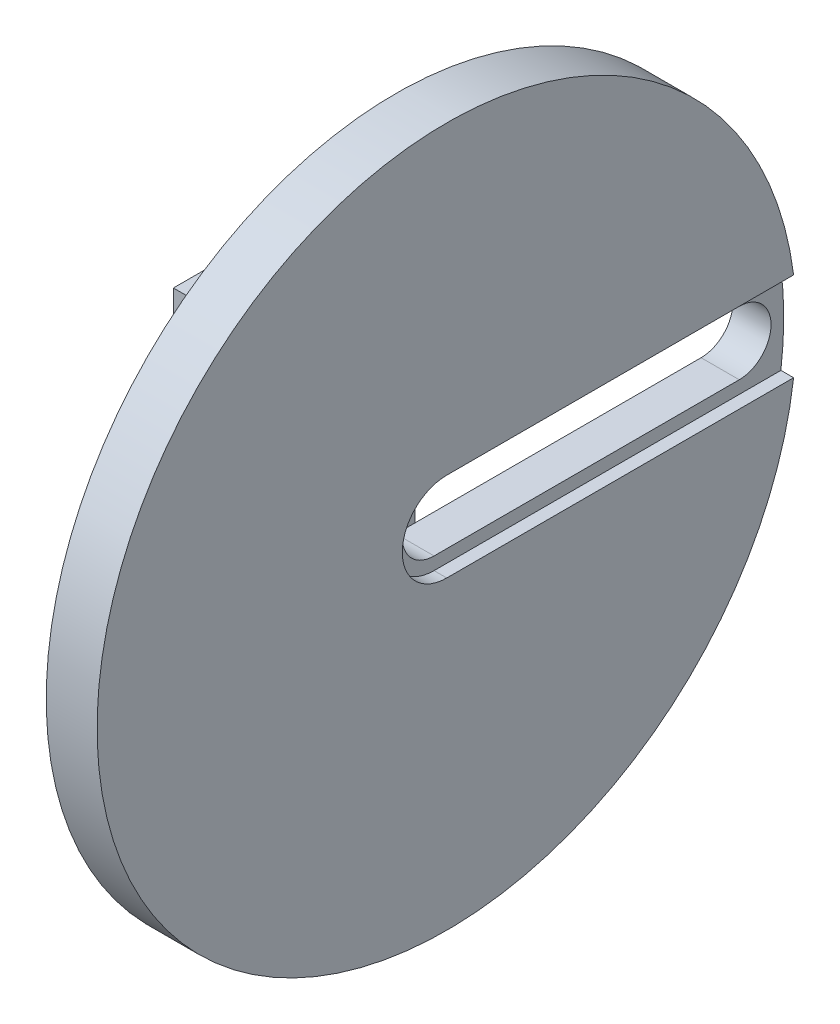
from build123d import *

# Parameters (mm, degrees)
SKETCH_1_R          = 7.5
EXTRUDE_1_DEPTH     = 10
SKETCH_5_W          = 30
SKETCH_5_H          = 52
EXTRUDE_2_DEPTH     = 8
SKETCH_6_W          = 30
SKETCH_6_H          = 8
EXTRUDE_3_DEPTH     = 12
SKETCH_7_R          = 55
EXTRUDE_4_DEPTH     = 8
CUT_EXTRUDE_4_REACH = 88.568
CUT_EXTRUDE_START   = -2
CUT_EXTRUDE_6_DEPTH = 2
CUT_EXTRUDE_7_REACH = 88.568
SKETCH_12_R         = 9


with BuildPart() as part:
    # 草图1 → 凸台-拉伸1 (new body)
    with BuildSketch(Plane(origin=(0, 0, 0), x_dir=(0, 0, -1), z_dir=(1, 0, 0))):
        Circle(SKETCH_1_R)
    extrude(amount=EXTRUDE_1_DEPTH)

    # 草图5 → 凸台-拉伸2 (add)
    with BuildSketch(Plane(origin=(10, 0, 0), x_dir=(0, 0, -1), z_dir=(1, 0, 0))):
        Rectangle(SKETCH_5_W, SKETCH_5_H)
    extrude(amount=EXTRUDE_2_DEPTH)

    # 草图6 → 凸台-拉伸3 (add)
    with BuildSketch(Plane(origin=(18, 0, 0), x_dir=(0, 0, -1), z_dir=(1, 0, 0))):
        with Locations((0, 22)):
            Rectangle(SKETCH_6_W, SKETCH_6_H)
        with Locations((0, -22)):
            Rectangle(SKETCH_6_W, SKETCH_6_H)
    extrude(amount=EXTRUDE_3_DEPTH)

    # 草图7 → 凸台-拉伸4 (add)
    with BuildSketch(Plane(origin=(30, 0, 0), x_dir=(0, 0, -1), z_dir=(1, 0, 0))):
        Circle(SKETCH_7_R)
    extrude(amount=EXTRUDE_4_DEPTH)

    # 草图8 → 切除-拉伸4 (cut, up to next)
    with BuildSketch(Plane(origin=(38, 0, 0), x_dir=(0, 0, -1), z_dir=(1, 0, 0)), mode=Mode.PRIVATE) as cut_extrude_4_sk1:
        with BuildLine():
            Line((0, 5), (48, 5))
            ThreePointArc((48, 5), (53, 0), (48, -5))
            Line((48, -5), (0, -5))
            ThreePointArc((0, -5), (-5, 0), (0, 5))
        make_face()
    cut_extrude_4_tool1 = extrude(cut_extrude_4_sk1.sketch, amount=-CUT_EXTRUDE_4_REACH, mode=Mode.PRIVATE) & part.part
    add(cut_extrude_4_tool1.solids().sort_by_distance((38, 0, -24))[0], mode=Mode.SUBTRACT)

    # 草图11 → 切除-拉伸6 (cut)
    with BuildSketch(Plane(origin=(38, 0, 0), x_dir=(0, 0, -1), z_dir=(1, 0, 0)).offset(CUT_EXTRUDE_START)):
        with BuildLine():
            Line((0, 7), (54.552726788, 7))
            ThreePointArc((54.552726788, 7), (55, 0), (54.552726788, -7))
            Line((54.552726788, -7), (0, -7))
            ThreePointArc((0, -7), (-7, 0), (0, 7))
        make_face()
    extrude(amount=CUT_EXTRUDE_6_DEPTH, mode=Mode.SUBTRACT)

    # 草图12 → 切除-拉伸7 (cut, up to next)
    with BuildSketch(Plane.ZY, mode=Mode.PRIVATE) as cut_extrude_7_sk1:
        Circle(SKETCH_12_R)
    cut_extrude_7_tool1 = extrude(cut_extrude_7_sk1.sketch, amount=-CUT_EXTRUDE_7_REACH, mode=Mode.PRIVATE) & part.part
    add(cut_extrude_7_tool1.solids().sort_by_distance((0, 0, 0))[0], mode=Mode.SUBTRACT)


solid = part.part
